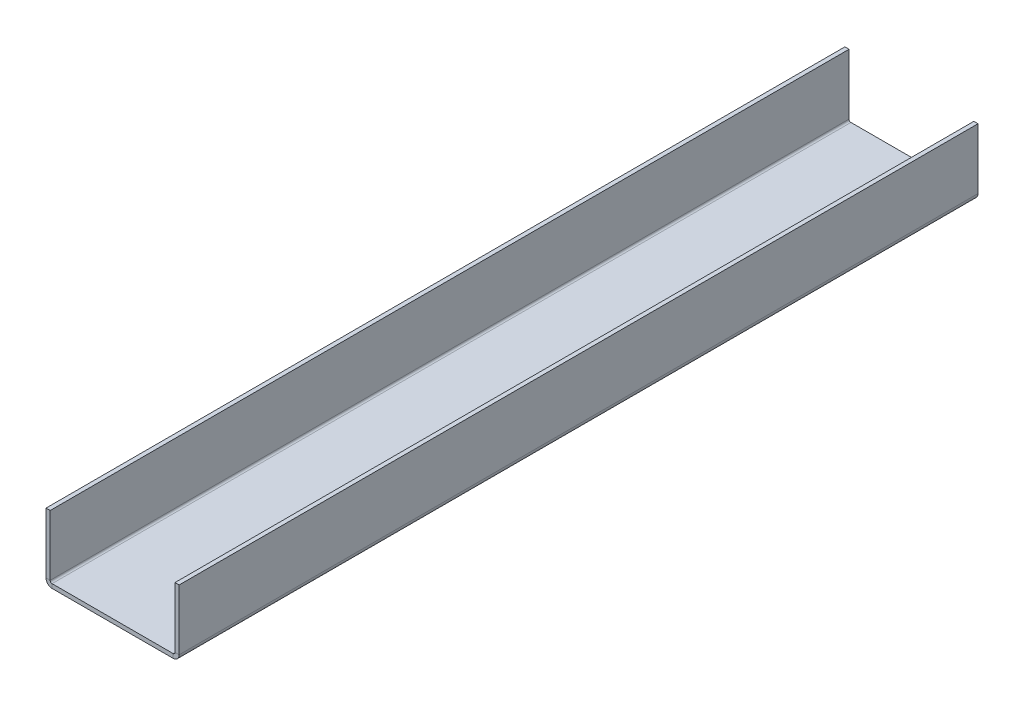
from build123d import *

# Parameters (mm, degrees)
SKETCH1_W                    = 50.8
SKETCH1_H                    = 304.8
BASE_FLANGE1_DEPTH           = 1.5875
EDGE_FLANGE1_STRIP_W         = 7.8232
EDGE_FLANGE1_STRIP_H         = 1.5875
EDGE_FLANGE1_STRIP_CUT_DEPTH = 304.8
EDGE_FLANGE1_DEPTH           = 304.8
EDGE_FLANGE2_STRIP_W         = 7.8232
EDGE_FLANGE2_STRIP_H         = 1.5875
EDGE_FLANGE2_STRIP_CUT_DEPTH = 304.8
EDGE_FLANGE2_DEPTH           = 304.8


# Sheet-metal steps are written as plain solids
with BuildPart() as part:
    # Sketch1 → Base-Flange1 (new body)
    with BuildSketch(Plane(origin=(0, 0, 0), x_dir=(1, 0, 0), z_dir=(0, 1, 0))):
        Rectangle(SKETCH1_W, SKETCH1_H)
    extrude(amount=-BASE_FLANGE1_DEPTH)

    # Edge-Flange1 strip (across the edge) → Edge-Flange1 strip cut (cut)
    with BuildSketch(Plane(origin=(25.4, 0, 152.4), x_dir=(-1, 0, 0), z_dir=(0, 0, -1))):
        with Locations((-1.5875, -0.79375)):
            Rectangle(EDGE_FLANGE1_STRIP_W, EDGE_FLANGE1_STRIP_H)
    extrude(amount=EDGE_FLANGE1_STRIP_CUT_DEPTH, mode=Mode.SUBTRACT)

    # Edge-Flange1 section (across the edge) → Edge-Flange1 (add)
    with BuildSketch(Plane(origin=(25.4, 0, 152.4), x_dir=(-1, 0, 0), z_dir=(0, 0, -1))):
        with BuildLine():
            Line((0, 0.7366), (0, 23.8125))
            Line((0, 23.8125), (1.5875, 23.8125))
            Line((1.5875, 23.8125), (1.5875, 0.7366))
            ThreePointArc((1.5875, 0.7366), (1.803245145, 0.215745145), (2.3241, 0))
            Line((2.3241, 0), (2.3241, -1.5875))
            ThreePointArc((2.3241, -1.5875), (0.68071313, -0.90678687), (0, 0.7366))
        make_face()
    extrude(amount=EDGE_FLANGE1_DEPTH)

    # Edge-Flange2 strip (across the edge) → Edge-Flange2 strip cut (cut)
    with BuildSketch(Plane(origin=(-25.4, 0, -152.4), x_dir=(1, 0, 0), z_dir=(0, 0, 1))):
        with Locations((-1.5875, -0.79375)):
            Rectangle(EDGE_FLANGE2_STRIP_W, EDGE_FLANGE2_STRIP_H)
    extrude(amount=EDGE_FLANGE2_STRIP_CUT_DEPTH, mode=Mode.SUBTRACT)

    # Edge-Flange2 section (across the edge) → Edge-Flange2 (add)
    with BuildSketch(Plane(origin=(-25.4, 0, -152.4), x_dir=(1, 0, 0), z_dir=(0, 0, 1))):
        with BuildLine():
            Line((0, 0.7366), (0, 23.8125))
            Line((0, 23.8125), (1.5875, 23.8125))
            Line((1.5875, 23.8125), (1.5875, 0.7366))
            ThreePointArc((1.5875, 0.7366), (1.803245145, 0.215745145), (2.3241, 0))
            Line((2.3241, 0), (2.3241, -1.5875))
            ThreePointArc((2.3241, -1.5875), (0.68071313, -0.90678687), (0, 0.7366))
        make_face()
    extrude(amount=EDGE_FLANGE2_DEPTH)


solid = part.part
